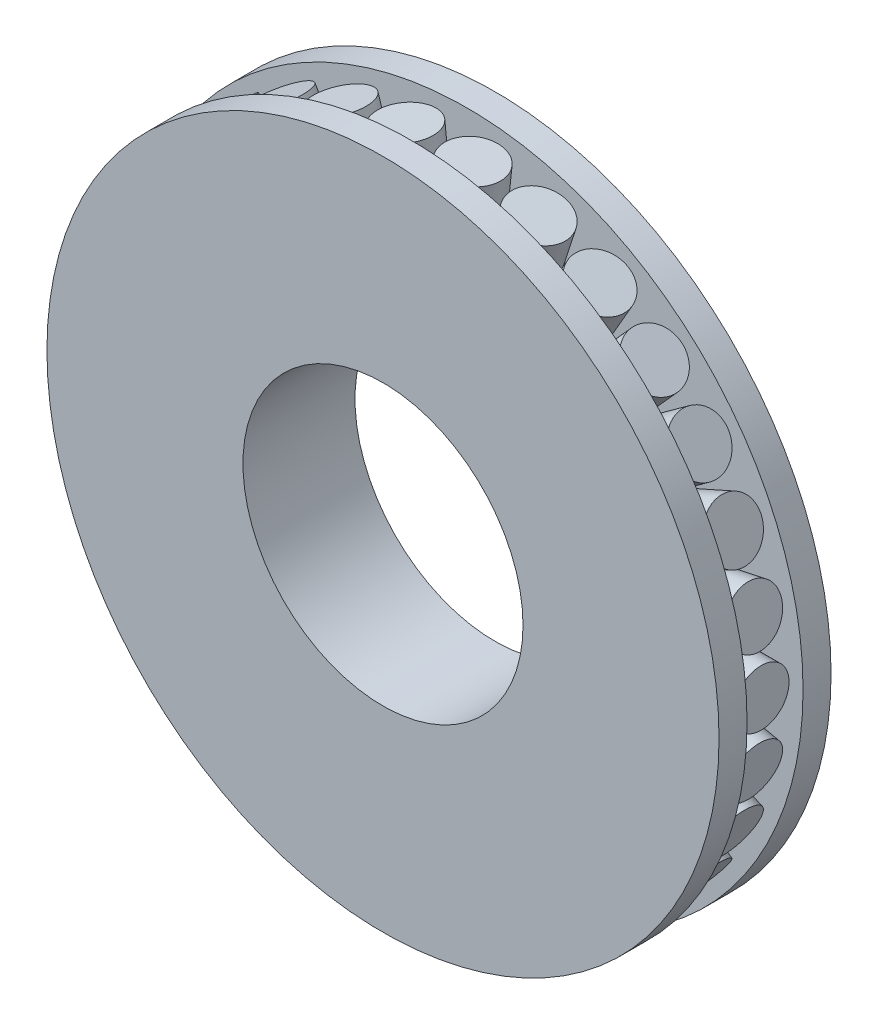
from build123d import *

# Parameters (mm, degrees)
SKETCH_1_R               = 12
SKETCH_1_R_2             = 5
EXTRUDE_1_DEPTH          = 4
CUT_EXTRUDE_1_DEPTH      = 1
CUT_EXTRUDE_1_DEPTH_BACK = 1
SKETCH_2_R               = 12
SKETCH_2_R_2             = 7
EXTRUDE_2_DEPTH          = 4
EXTRUDE_2_DEPTH_BACK     = 0.5
SKETCH_4_R               = 1
PATTERN_CIRCULAR_1_COUNT = 30


with BuildPart() as part:
    # 草图1 → 凸台-拉伸1 (new body)
    with BuildSketch(Plane.XY):
        Circle(SKETCH_1_R)
        Circle(SKETCH_1_R_2, mode=Mode.SUBTRACT)
    extrude(amount=EXTRUDE_1_DEPTH)

    # 草图2 → 切除-拉伸1 (cut, two sides: drawn at the far end of the back side and taken through both)
    with BuildSketch(Plane(origin=(0, 0, 2), x_dir=(-1, 0, 0), z_dir=(0, 0, -1)).offset(-CUT_EXTRUDE_1_DEPTH_BACK)):
        Circle(SKETCH_2_R)
        Circle(SKETCH_2_R_2, mode=Mode.SUBTRACT)
    extrude(amount=CUT_EXTRUDE_1_DEPTH + CUT_EXTRUDE_1_DEPTH_BACK, mode=Mode.SUBTRACT)


with BuildPart() as body_2:
    # 草图4 → 凸台-拉伸2 (new, two sides: drawn at the far end of the back side and taken through both)
    with BuildSketch(Plane(origin=(-11, 0, 0), x_dir=(0, 0, -1), z_dir=(1, 0, 0)).offset(-EXTRUDE_2_DEPTH_BACK)):
        with Locations((-2, 0)):
            Circle(SKETCH_4_R)
    extrude(amount=EXTRUDE_2_DEPTH + EXTRUDE_2_DEPTH_BACK)


with BuildPart() as pattern_circular_1_1:
    # 阵列(圆周)1: pattern copy
    add(body_2.part.rotate(Axis((0, 0, 4), (0, 0, -1)), 1 * 360 / PATTERN_CIRCULAR_1_COUNT))


with BuildPart() as pattern_circular_1_2:
    # 阵列(圆周)1: pattern copy
    add(body_2.part.rotate(Axis((0, 0, 4), (0, 0, -1)), 2 * 360 / PATTERN_CIRCULAR_1_COUNT))


with BuildPart() as pattern_circular_1_3:
    # 阵列(圆周)1: pattern copy
    add(body_2.part.rotate(Axis((0, 0, 4), (0, 0, -1)), 3 * 360 / PATTERN_CIRCULAR_1_COUNT))


with BuildPart() as pattern_circular_1_4:
    # 阵列(圆周)1: pattern copy
    add(body_2.part.rotate(Axis((0, 0, 4), (0, 0, -1)), 4 * 360 / PATTERN_CIRCULAR_1_COUNT))


with BuildPart() as pattern_circular_1_5:
    # 阵列(圆周)1: pattern copy
    add(body_2.part.rotate(Axis((0, 0, 4), (0, 0, -1)), 5 * 360 / PATTERN_CIRCULAR_1_COUNT))


with BuildPart() as pattern_circular_1_6:
    # 阵列(圆周)1: pattern copy
    add(body_2.part.rotate(Axis((0, 0, 4), (0, 0, -1)), 6 * 360 / PATTERN_CIRCULAR_1_COUNT))


with BuildPart() as pattern_circular_1_7:
    # 阵列(圆周)1: pattern copy
    add(body_2.part.rotate(Axis((0, 0, 4), (0, 0, -1)), 7 * 360 / PATTERN_CIRCULAR_1_COUNT))


with BuildPart() as pattern_circular_1_8:
    # 阵列(圆周)1: pattern copy
    add(body_2.part.rotate(Axis((0, 0, 4), (0, 0, -1)), 8 * 360 / PATTERN_CIRCULAR_1_COUNT))


with BuildPart() as pattern_circular_1_9:
    # 阵列(圆周)1: pattern copy
    add(body_2.part.rotate(Axis((0, 0, 4), (0, 0, -1)), 9 * 360 / PATTERN_CIRCULAR_1_COUNT))


with BuildPart() as pattern_circular_1_10:
    # 阵列(圆周)1: pattern copy
    add(body_2.part.rotate(Axis((0, 0, 4), (0, 0, -1)), 10 * 360 / PATTERN_CIRCULAR_1_COUNT))


with BuildPart() as pattern_circular_1_11:
    # 阵列(圆周)1: pattern copy
    add(body_2.part.rotate(Axis((0, 0, 4), (0, 0, -1)), 11 * 360 / PATTERN_CIRCULAR_1_COUNT))


with BuildPart() as pattern_circular_1_12:
    # 阵列(圆周)1: pattern copy
    add(body_2.part.rotate(Axis((0, 0, 4), (0, 0, -1)), 12 * 360 / PATTERN_CIRCULAR_1_COUNT))


with BuildPart() as pattern_circular_1_13:
    # 阵列(圆周)1: pattern copy
    add(body_2.part.rotate(Axis((0, 0, 4), (0, 0, -1)), 13 * 360 / PATTERN_CIRCULAR_1_COUNT))


with BuildPart() as pattern_circular_1_14:
    # 阵列(圆周)1: pattern copy
    add(body_2.part.rotate(Axis((0, 0, 4), (0, 0, -1)), 14 * 360 / PATTERN_CIRCULAR_1_COUNT))


with BuildPart() as pattern_circular_1_15:
    # 阵列(圆周)1: pattern copy
    add(body_2.part.rotate(Axis((0, 0, 4), (0, 0, -1)), 15 * 360 / PATTERN_CIRCULAR_1_COUNT))


with BuildPart() as pattern_circular_1_16:
    # 阵列(圆周)1: pattern copy
    add(body_2.part.rotate(Axis((0, 0, 4), (0, 0, -1)), 16 * 360 / PATTERN_CIRCULAR_1_COUNT))


with BuildPart() as pattern_circular_1_17:
    # 阵列(圆周)1: pattern copy
    add(body_2.part.rotate(Axis((0, 0, 4), (0, 0, -1)), 17 * 360 / PATTERN_CIRCULAR_1_COUNT))


with BuildPart() as pattern_circular_1_18:
    # 阵列(圆周)1: pattern copy
    add(body_2.part.rotate(Axis((0, 0, 4), (0, 0, -1)), 18 * 360 / PATTERN_CIRCULAR_1_COUNT))


with BuildPart() as pattern_circular_1_19:
    # 阵列(圆周)1: pattern copy
    add(body_2.part.rotate(Axis((0, 0, 4), (0, 0, -1)), 19 * 360 / PATTERN_CIRCULAR_1_COUNT))


with BuildPart() as pattern_circular_1_20:
    # 阵列(圆周)1: pattern copy
    add(body_2.part.rotate(Axis((0, 0, 4), (0, 0, -1)), 20 * 360 / PATTERN_CIRCULAR_1_COUNT))


with BuildPart() as pattern_circular_1_21:
    # 阵列(圆周)1: pattern copy
    add(body_2.part.rotate(Axis((0, 0, 4), (0, 0, -1)), 21 * 360 / PATTERN_CIRCULAR_1_COUNT))


with BuildPart() as pattern_circular_1_22:
    # 阵列(圆周)1: pattern copy
    add(body_2.part.rotate(Axis((0, 0, 4), (0, 0, -1)), 22 * 360 / PATTERN_CIRCULAR_1_COUNT))


with BuildPart() as pattern_circular_1_23:
    # 阵列(圆周)1: pattern copy
    add(body_2.part.rotate(Axis((0, 0, 4), (0, 0, -1)), 23 * 360 / PATTERN_CIRCULAR_1_COUNT))


with BuildPart() as pattern_circular_1_24:
    # 阵列(圆周)1: pattern copy
    add(body_2.part.rotate(Axis((0, 0, 4), (0, 0, -1)), 24 * 360 / PATTERN_CIRCULAR_1_COUNT))


with BuildPart() as pattern_circular_1_25:
    # 阵列(圆周)1: pattern copy
    add(body_2.part.rotate(Axis((0, 0, 4), (0, 0, -1)), 25 * 360 / PATTERN_CIRCULAR_1_COUNT))


with BuildPart() as pattern_circular_1_26:
    # 阵列(圆周)1: pattern copy
    add(body_2.part.rotate(Axis((0, 0, 4), (0, 0, -1)), 26 * 360 / PATTERN_CIRCULAR_1_COUNT))


with BuildPart() as pattern_circular_1_27:
    # 阵列(圆周)1: pattern copy
    add(body_2.part.rotate(Axis((0, 0, 4), (0, 0, -1)), 27 * 360 / PATTERN_CIRCULAR_1_COUNT))


with BuildPart() as pattern_circular_1_28:
    # 阵列(圆周)1: pattern copy
    add(body_2.part.rotate(Axis((0, 0, 4), (0, 0, -1)), 28 * 360 / PATTERN_CIRCULAR_1_COUNT))


with BuildPart() as pattern_circular_1_29:
    # 阵列(圆周)1: pattern copy
    add(body_2.part.rotate(Axis((0, 0, 4), (0, 0, -1)), 29 * 360 / PATTERN_CIRCULAR_1_COUNT))


solid = Compound([part.part, body_2.part, pattern_circular_1_1.part, pattern_circular_1_2.part, pattern_circular_1_3.part, pattern_circular_1_4.part, pattern_circular_1_5.part, pattern_circular_1_6.part, pattern_circular_1_7.part, pattern_circular_1_8.part, pattern_circular_1_9.part, pattern_circular_1_10.part, pattern_circular_1_11.part, pattern_circular_1_12.part, pattern_circular_1_13.part, pattern_circular_1_14.part, pattern_circular_1_15.part, pattern_circular_1_16.part, pattern_circular_1_17.part, pattern_circular_1_18.part, pattern_circular_1_19.part, pattern_circular_1_20.part, pattern_circular_1_21.part, pattern_circular_1_22.part, pattern_circular_1_23.part, pattern_circular_1_24.part, pattern_circular_1_25.part, pattern_circular_1_26.part, pattern_circular_1_27.part, pattern_circular_1_28.part, pattern_circular_1_29.part])
